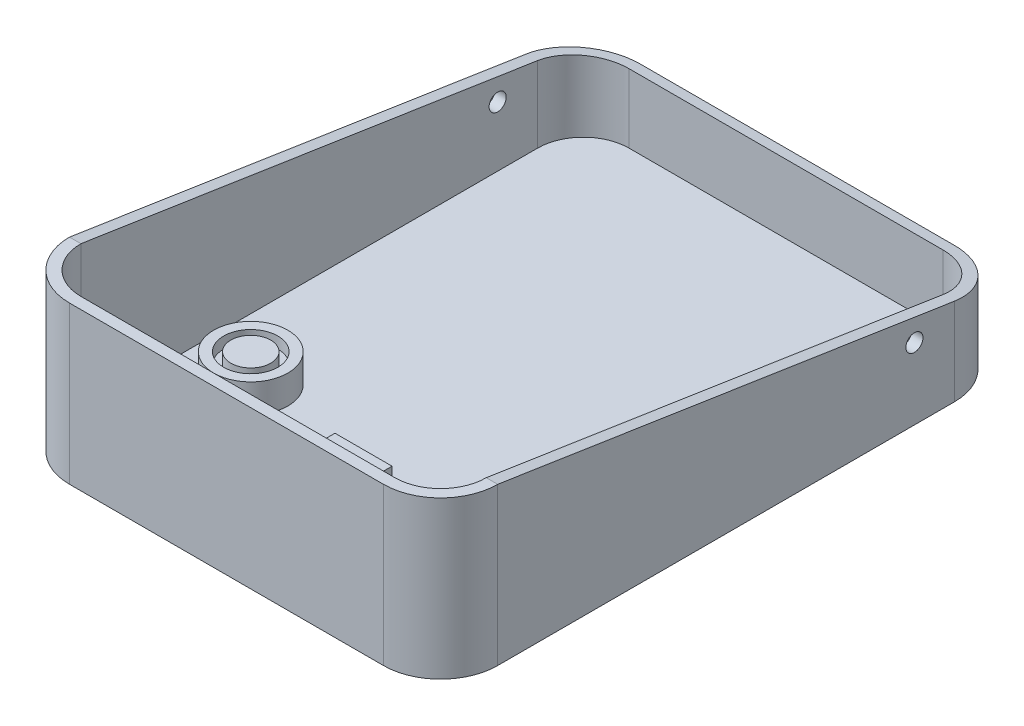
from build123d import *

# Parameters (mm, degrees)
BOSS_EXTRUDE1_DEPTH = 27.5
SKETCH2_W           = 65
SKETCH2_H           = 4
BOSS_EXTRUDE2_DEPTH = 2
FILLET1_R           = 2
SHELL1_START        = 2
SHELL1_DEPTH        = 25.5
CUT_EXTRUDE1_REACH  = 96.24
SKETCH5_W           = 10
SKETCH5_H           = 12
BOSS_EXTRUDE3_DEPTH = 5
SKETCH7_R           = 6.5
BOSS_EXTRUDE4_DEPTH = 5
SKETCH8_R           = 4.75
SKETCH8_R_2         = 3.5
CUT_EXTRUDE2_DEPTH  = 2
SKETCH9_R           = 1.5
CUT_EXTRUDE3_DEPTH  = 95.240384125


# Read off the part's stored shape, not the designer's step: Shell1
with BuildPart() as part:
    # Sketch1 → Boss-Extrude1 (new body)
    with BuildSketch(Plane(origin=(0, 0, 0), x_dir=(1, 0, 0), z_dir=(0, 1, 0))):
        with BuildLine():
            Line((-27.5, -50), (27.5, -50))
            ThreePointArc((27.5, -50), (34.571067812, -47.071067812), (37.5, -40))
            Line((37.5, -40), (37.5, 40))
            ThreePointArc((37.5, 40), (34.571067812, 47.071067812), (27.5, 50))
            Line((27.5, 50), (-27.5, 50))
            ThreePointArc((-27.5, 50), (-34.571067812, 47.071067812), (-37.5, 40))
            Line((-37.5, 40), (-37.5, -40))
            ThreePointArc((-37.5, -40), (-34.571067812, -47.071067812), (-27.5, -50))
        make_face()
    extrude(amount=BOSS_EXTRUDE1_DEPTH)

    # Sketch2 → Boss-Extrude2 (add)
    with BuildSketch(Plane.XZ):
        with Locations((0, -40)):
            Rectangle(SKETCH2_W, SKETCH2_H)
        with Locations((0, -33.5)):
            Rectangle(SKETCH2_W, SKETCH2_H)
        with Locations((0, -27)):
            Rectangle(SKETCH2_W, SKETCH2_H)
        with Locations((0, -20.5)):
            Rectangle(SKETCH2_W, SKETCH2_H)
        with Locations((0, -14)):
            Rectangle(SKETCH2_W, SKETCH2_H)
        with Locations((0, -7.5)):
            Rectangle(SKETCH2_W, SKETCH2_H)
        with Locations((0, -1)):
            Rectangle(SKETCH2_W, SKETCH2_H)
        with Locations((0, 5.5)):
            Rectangle(SKETCH2_W, SKETCH2_H)
        with Locations((0, 12)):
            Rectangle(SKETCH2_W, SKETCH2_H)
        with Locations((0, 18.5)):
            Rectangle(SKETCH2_W, SKETCH2_H)
        with Locations((0, 25)):
            Rectangle(SKETCH2_W, SKETCH2_H)
        with Locations((0, 31.5)):
            Rectangle(SKETCH2_W, SKETCH2_H)
        with Locations((0, 38)):
            Rectangle(SKETCH2_W, SKETCH2_H)
    extrude(amount=BOSS_EXTRUDE2_DEPTH)

    # Fillet1
    fillet1_edges = [part.edges().sort_by_distance(p)[0] for p in [
        (-32.5, -2, 38),
        (0, -2, 40),
        (32.5, -2, 38),
        (0, -2, 36),
        (-32.5, -2, 31.5),
        (0, -2, 33.5),
        (32.5, -2, 31.5),
        (0, -2, 29.5),
        (-32.5, -2, 12),
        (0, -2, 14),
        (32.5, -2, 12),
        (0, -2, 10),
        (-32.5, -2, 18.5),
        (0, -2, 20.5),
        (32.5, -2, 18.5),
        (0, -2, 16.5),
        (-32.5, -2, -40),
        (0, -2, -38),
        (32.5, -2, -40),
        (0, -2, -42),
        (0, -2, -35.5),
        (-32.5, -2, -33.5),
        (0, -2, -31.5),
        (32.5, -2, -33.5),
        (-32.5, -2, -27),
        (0, -2, -25),
        (32.5, -2, -27),
        (0, -2, -29),
        (-32.5, -2, -20.5),
        (0, -2, -18.5),
        (32.5, -2, -20.5),
        (0, -2, -22.5),
        (-32.5, -2, -14),
        (0, -2, -12),
        (32.5, -2, -14),
        (0, -2, -16),
        (-32.5, -2, -7.5),
        (0, -2, -5.5),
        (32.5, -2, -7.5),
        (0, -2, -9.5),
        (-32.5, -2, -1),
        (0, -2, 1),
        (32.5, -2, -1),
        (0, -2, -3),
        (-32.5, -2, 5.5),
        (0, -2, 7.5),
        (32.5, -2, 5.5),
        (0, -2, 3.5),
        (0, -2, 23),
        (-32.5, -2, 25),
        (0, -2, 27),
        (32.5, -2, 25),
    ]]
    fillet(fillet1_edges, radius=FILLET1_R - 0.0001)  # a hair under: the kernel refuses the full size

    # Shell1 outline → Shell1 (cut)
    with BuildSketch(Plane(origin=(0, 0, 0), x_dir=(1, 0, 0), z_dir=(0, 1, 0)).offset(SHELL1_START)):
        with BuildLine():
            ThreePointArc((-35.5, -40), (-33.156854249, -45.656854249), (-27.5, -48))
            Line((-27.5, -48), (27.5, -48))
            ThreePointArc((27.5, -48), (33.156854249, -45.656854249), (35.5, -40))
            Line((35.5, -40), (35.5, 40))
            ThreePointArc((35.5, 40), (33.156854249, 45.656854249), (27.5, 48))
            Line((27.5, 48), (-27.5, 48))
            ThreePointArc((-27.5, 48), (-33.156854249, 45.656854249), (-35.5, 40))
            Line((-35.5, 40), (-35.5, -40))
        make_face()
    extrude(amount=SHELL1_DEPTH, mode=Mode.SUBTRACT)

    # Cut-Extrude1: up to this face of the body (flat: up to its plane)
    cut_extrude1_end = Plane(part.part.faces().sort_by_distance((-37.5, 13.75, 0))[0])
    # Sketch4 → Cut-Extrude1 (cut, up to the picked face)
    with BuildSketch(Plane(origin=(37.5, 0, 0), x_dir=(0, 0, -1), z_dir=(1, 0, 0)), mode=Mode.PRIVATE) as cut_extrude1_sk1:
        Polygon((40, 27.5), (-40, 27.5), (50, 13.75), (50, 27.5), align=None)
    cut_extrude1_tool1 = split(extrude(cut_extrude1_sk1.sketch, amount=-CUT_EXTRUDE1_REACH, mode=Mode.PRIVATE), bisect_by=cut_extrude1_end, keep=Keep.BOTH, mode=Mode.PRIVATE)
    add(cut_extrude1_tool1.solids().sort_by(Axis((37.5, 22.916667, -20), (-1, 0, 0)))[0], mode=Mode.SUBTRACT)

    # Sketch5 → Boss-Extrude3 (add)
    with BuildSketch(Plane(origin=(0, 2, 0), x_dir=(1, 0, 0), z_dir=(0, 1, 0))):
        with Locations((0, -32)):
            Rectangle(SKETCH5_W, SKETCH5_H)
    extrude(amount=BOSS_EXTRUDE3_DEPTH)

    # Sketch7 → Boss-Extrude4 (add)
    with BuildSketch(Plane(origin=(0, 2, 0), x_dir=(1, 0, 0), z_dir=(0, 1, 0))):
        with Locations(Location((-24.75, -21, 0), (0, 0, 270))):
            Circle(SKETCH7_R)
        with Locations(Location((24.75, -21, 0), (0, 0, 270))):
            Circle(SKETCH7_R)
    extrude(amount=BOSS_EXTRUDE4_DEPTH)

    # Sketch8 → Cut-Extrude2 (cut)
    # profile 1 of 2: a face of its own
    with BuildSketch(Plane(origin=(0, 7, 0), x_dir=(1, 0, 0), z_dir=(0, 1, 0))):
        with Locations(Location((-24.75, -21, 0), (0, 0, 270))):
            Circle(SKETCH8_R)
        with Locations(Location((-24.75, -21, 0), (0, 0, 270))):
            Circle(SKETCH8_R_2, mode=Mode.SUBTRACT)
    # profile 2 of 2: a face of its own
    with BuildSketch(Plane(origin=(0, 7, 0), x_dir=(1, 0, 0), z_dir=(0, 1, 0))):
        with Locations(Location((24.75, -21, 0), (0, 0, 270))):
            Circle(SKETCH8_R)
        with Locations(Location((24.75, -21, 0), (0, 0, 270))):
            Circle(SKETCH8_R_2, mode=Mode.SUBTRACT)
    extrude(amount=-CUT_EXTRUDE2_DEPTH, mode=Mode.SUBTRACT)

    # Sketch9 → Cut-Extrude3 (cut, through all)
    with BuildSketch(Plane(origin=(37.5, 0, 0), x_dir=(0, 0, -1), z_dir=(1, 0, 0))):
        with Locations((33, 12.5)):
            Circle(SKETCH9_R)
    extrude(amount=-CUT_EXTRUDE3_DEPTH, mode=Mode.SUBTRACT)


solid = part.part
